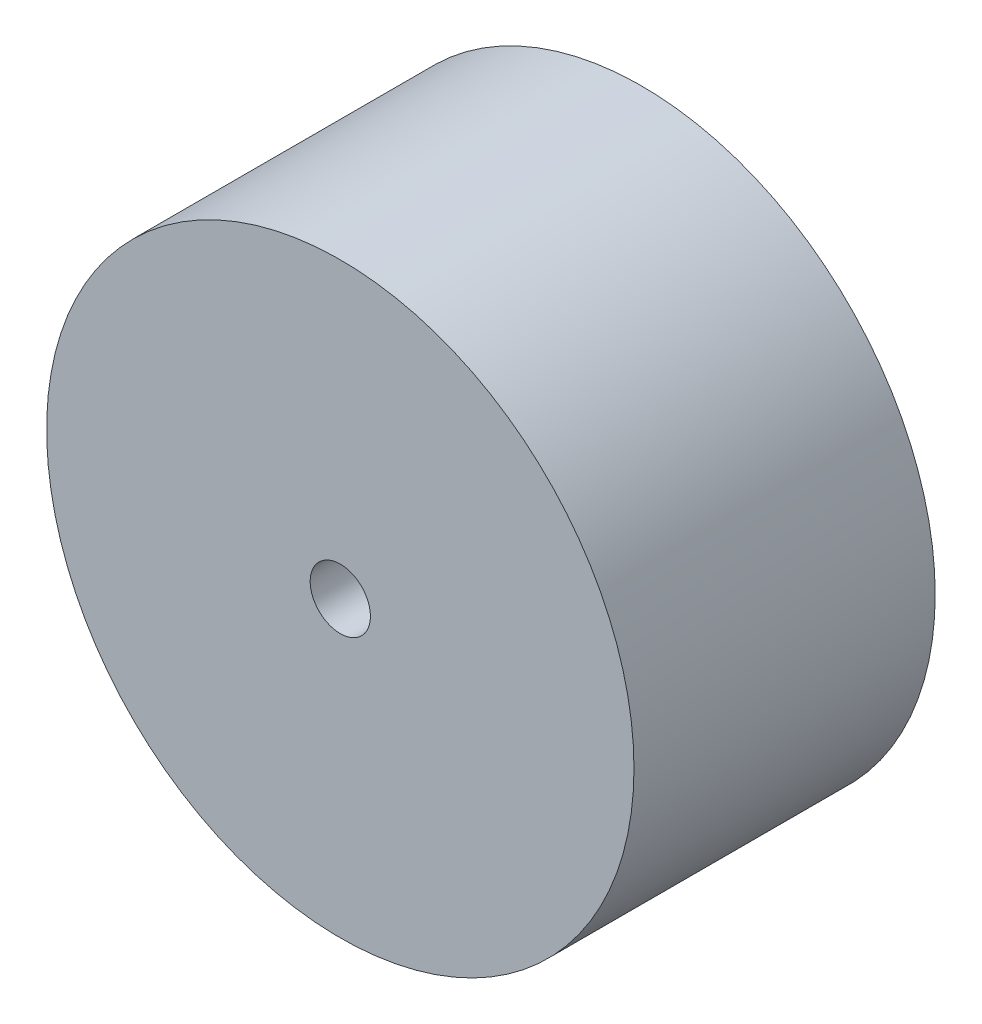
from build123d import *

# Parameters (mm, degrees)
SKETCH1_R           = 19.5
BOSS_EXTRUDE1_DEPTH = 20
SKETCH2_R           = 2
CUT_EXTRUDE1_DEPTH  = 35.066112194


with BuildPart() as part:
    # Sketch1 → Boss-Extrude1 (new body)
    with BuildSketch(Plane.XY):
        Circle(SKETCH1_R)
    extrude(amount=BOSS_EXTRUDE1_DEPTH)

    # Sketch2 → Cut-Extrude1 (cut, through all)
    with BuildSketch(Plane.XY.offset(20)):
        Circle(SKETCH2_R)
    extrude(amount=-CUT_EXTRUDE1_DEPTH, mode=Mode.SUBTRACT)


solid = part.part
